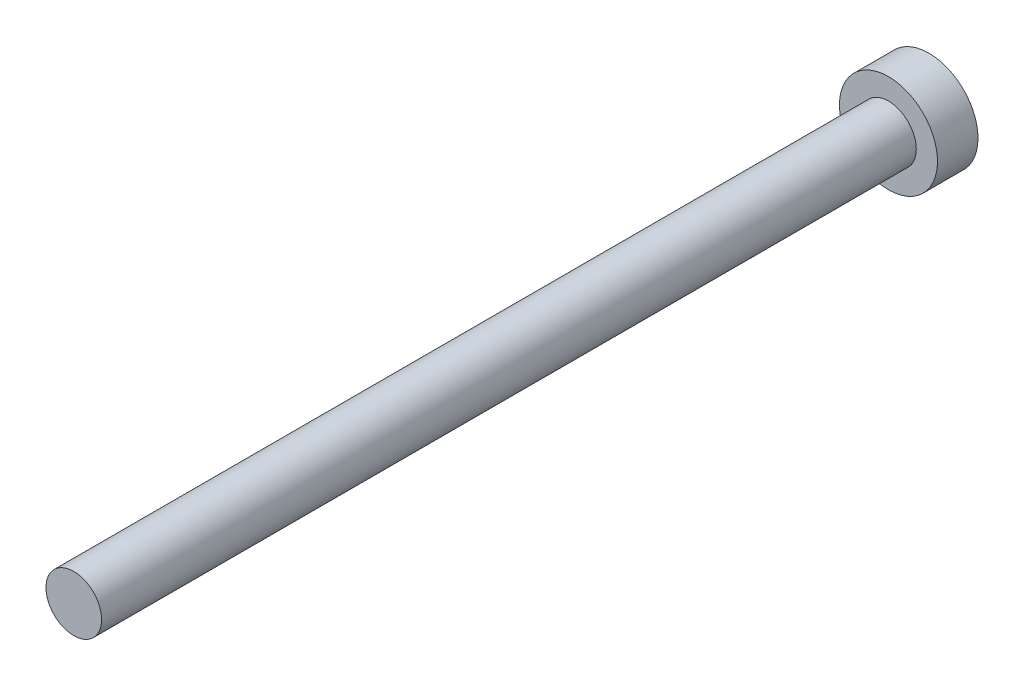
from build123d import *

# Parameters (mm, degrees)
SKETCH1_R                           = 1.5
BOSS_EXTRUDE1_DEPTH                 = 42
SKETCH2_R                           = 2.75
BOSS_EXTRUDE2_DEPTH                 = 2.2
ESCALA1_SCALE                       = 1.5
ESCALA2_SCALE                       = 1.5
CROQUIS1_R                          = 3.4
SALIENTE_EXTRUIR1_DEPTH             = 10
SALIENTE_EXTRUIR1_DIRECTION_2_REACH = 96.904
CORTAR_EXTRUIR1_DEPTH               = 105.865725156
CORTAR_EXTRUIR1_DEPTH_BACK          = 105.865725156
CROQUIS2_OUTSIDE_W                  = 35.568
CROQUIS2_OUTSIDE_H                  = 35.568
CROQUIS2_OUTSIDE_R                  = 5.99


with BuildPart() as part:
    # Sketch1 → Boss-Extrude1 (new body)
    with BuildSketch(Plane.XY):
        Circle(SKETCH1_R)
    extrude(amount=BOSS_EXTRUDE1_DEPTH)

    # Sketch2 → Boss-Extrude2 (add)
    with BuildSketch(Plane(origin=(0, 0, 0), x_dir=(-1, 0, 0), z_dir=(0, 0, -1))):
        Circle(SKETCH2_R)
    extrude(amount=-BOSS_EXTRUDE2_DEPTH)


with BuildPart() as part_1:
    # Escala1: scaled about (0, 0, 0)
    add(part.part.scale(ESCALA1_SCALE))


with BuildPart() as part_2:
    # Escala2: scaled about (0, 0, 0)
    add(part_1.part.scale(ESCALA2_SCALE))

    # Croquis1 → Saliente-Extruir1 (add)
    with BuildSketch(Plane.XY.offset(94.5)):
        Circle(CROQUIS1_R)
    extrude(amount=SALIENTE_EXTRUIR1_DEPTH)

    # Croquis1 → Saliente-Extruir1 direction 2 (add, up to next)
    with BuildSketch(Plane.XY.offset(94.5), mode=Mode.PRIVATE) as saliente_extruir1_direction_2_sk1:
        Circle(CROQUIS1_R)
    saliente_extruir1_direction_2_tool1 = extrude(saliente_extruir1_direction_2_sk1.sketch, amount=-SALIENTE_EXTRUIR1_DIRECTION_2_REACH, mode=Mode.PRIVATE) - part_2.part
    add(saliente_extruir1_direction_2_tool1.solids().sort_by_distance((0, 0, 94.5))[0])

    # Croquis2 outside → Cortar-Extruir1 (cut, two sides: drawn at the far end of the back side and taken through both)
    with BuildSketch(Plane(origin=(0, 0, 0), x_dir=(-1, 0, 0), z_dir=(0, 0, -1)).offset(-CORTAR_EXTRUIR1_DEPTH_BACK)):
        Rectangle(CROQUIS2_OUTSIDE_W, CROQUIS2_OUTSIDE_H)
        Circle(CROQUIS2_OUTSIDE_R, mode=Mode.SUBTRACT)
    extrude(amount=CORTAR_EXTRUIR1_DEPTH + CORTAR_EXTRUIR1_DEPTH_BACK, mode=Mode.SUBTRACT)


solid = part_2.part
